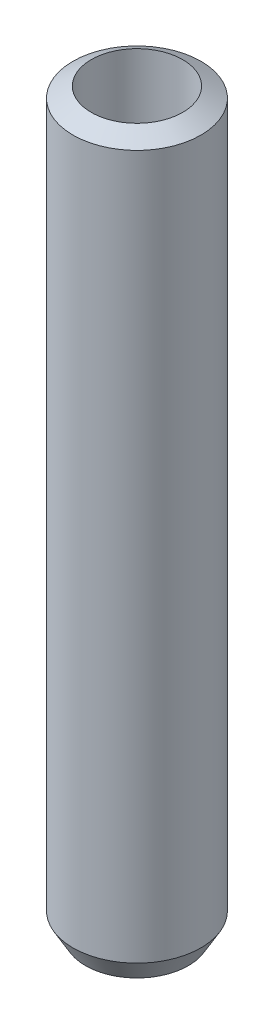
from build123d import *

# Parameters (mm, degrees)
SKETCH1_R           = 27.5
BOSS_EXTRUDE1_DEPTH = 317.215559
SKETCH2_R           = 19.658611568
CUT_EXTRUDE1_DEPTH  = 320.590692718
CHAMFER1_SIZE       = 5.390289
CHAMFER1_SIZE_2     = 9.336255


with BuildPart() as part:
    # Sketch1 → Boss-Extrude1 (new body)
    with BuildSketch(Plane(origin=(0, 0, 0), x_dir=(1, 0, 0), z_dir=(0, 1, 0))):
        with Locations(Location((0, 0, 0), (0, 0, 270))):
            Circle(SKETCH1_R)
    extrude(amount=BOSS_EXTRUDE1_DEPTH)

    # Sketch2 → Cut-Extrude1 (cut, through all)
    with BuildSketch(Plane(origin=(0, 0, 0), x_dir=(1, 0, 0), z_dir=(0, 1, 0))):
        with Locations(Location((0, 0, 0), (0, 0, 270))):
            Circle(SKETCH2_R)
    extrude(amount=CUT_EXTRUDE1_DEPTH, mode=Mode.SUBTRACT)

    # Chamfer1
    # the kernel refuses this chamfer: 9.336255, 5.390289 mm, written as the material it takes off along each edge
    with BuildSketch(Plane(origin=(0, 317.215559, 0), x_dir=(0, 0, 1), z_dir=(-1, 0, 0))) as chamfer1_piece_1:
        Polygon((27.5, -CHAMFER1_SIZE), (27.5 - CHAMFER1_SIZE_2, 0), (27.5, 0), align=None)
    revolve(axis=Axis((0, 317.215559, 0), (0, 1, 0)), mode=Mode.SUBTRACT)
    with BuildSketch(Plane(origin=(0, 0, 0), x_dir=(0, 0, 1), z_dir=(-1, 0, 0))) as chamfer1_piece_2:
        Polygon((27.5, CHAMFER1_SIZE_2), (27.5 - CHAMFER1_SIZE, 0), (27.5, 0), align=None)
    revolve(axis=Axis((0, 0, 0), (0, 1, 0)), mode=Mode.SUBTRACT)


solid = part.part
